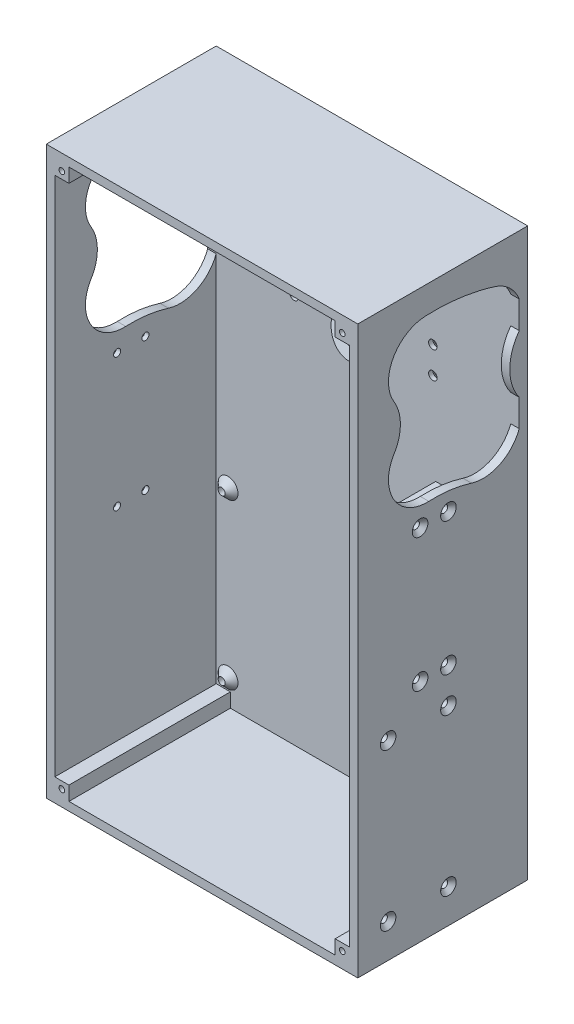
from build123d import *

# Parameters (mm, degrees)
SZKIC1_W                         = 110
SZKIC1_H                         = 60
DODANIE_WYCI_GNI_CIE1_DEPTH      = 200
SKORUPA1_T                       = -3
SZKIC16_W                        = 5
SZKIC16_H                        = 5
SZKIC16_R                        = 1
DODANIE_WYCI_GNI_CIE11_DEPTH     = 57
SZKIC8_W                         = 5
SZKIC8_H                         = 5
SZKIC8_R                         = 1
DODANIE_WYCI_GNI_CIE14_DEPTH     = 57
SZKIC12_W                        = 5
SZKIC12_H                        = 5
SZKIC12_R                        = 1
DODANIE_WYCI_GNI_CIE16_DEPTH     = 57
SZKIC14_W                        = 5
SZKIC14_H                        = 5
SZKIC14_R                        = 1
DODANIE_WYCI_GNI_CIE17_DEPTH     = 57
SZKIC17_W                        = 18.67
SZKIC17_H                        = 7.6
DODANIE_WYCI_GNI_CIE18_DEPTH     = 26.5
SZKIC18_R                        = 1.5
WYTNIJ_WYCI_GNI_CIE2_DEPTH       = 5
SZKIC19_R                        = 1.5
WYTNIJ_WYCI_GNI_CIE3_DEPTH       = 5
SZKIC21_R                        = 1.25
WYTNIJ_WYCI_GNI_CIE4_DEPTH       = 125
SFAZOWANIE3_SIZE                 = 1.5
WYTNIJ_WYCI_GNI_CIE5_DEPTH       = 10
WYTNIJ_WYCI_GNI_CIE10_DEPTH      = 125
WYTNIJ_WYCI_GNI_CIE10_DEPTH_BACK = 3
OBR_T1_ANGLE                     = 20
SZKIC49_R                        = 5.5
WYTNIJ_WYCI_GNI_CIE11_DEPTH      = 3
OBR_T2_ANGLE                     = 20
SZKIC51_R                        = 5.5
WYTNIJ_WYCI_GNI_CIE12_DEPTH      = 3
SZKIC52_R                        = 1.5
WYTNIJ_WYCI_GNI_CIE13_DEPTH      = 3
SFAZOWANIE4_SIZE                 = 1.5
SZKIC77_R                        = 1.25
SZKIC77_R_2                      = 1.247751647
WYTNIJ_WYCI_GNI_CIE16_DEPTH      = 4
SZKIC61_R                        = 1.25
WYTNIJ_WYCI_GNI_CIE17_DEPTH      = 10
SZKIC63_R                        = 1.25
WYTNIJ_WYCI_GNI_CIE18_DEPTH      = 10
SZKIC65_R                        = 1.25
WYTNIJ_WYCI_GNI_CIE19_DEPTH      = 10
SZKIC59_R                        = 1.25
WYTNIJ_WYCI_GNI_CIE20_DEPTH      = 10
SFAZOWANIE5_SIZE                 = 1.5


with BuildPart() as part:
    # Szkic1 → Dodanie-wyciągnięcie1 (new body)
    with BuildSketch(Plane(origin=(0, 0, 0), x_dir=(1, 0, 0), z_dir=(0, 1, 0))):
        with Locations((55, 30)):
            Rectangle(SZKIC1_W, SZKIC1_H)
    extrude(amount=DODANIE_WYCI_GNI_CIE1_DEPTH)

    # Skorupa1
    skorupa1_openings = [part.faces().sort_by_distance(p)[0] for p in [
        (55, 100, 0),
    ]]
    offset(amount=SKORUPA1_T, openings=skorupa1_openings, kind=Kind.INTERSECTION)

    # Szkic16 → Dodanie-wyciągnięcie11 (add)
    with BuildSketch(Plane.XY.offset(-57)):
        with Locations((5.5, 5.5)):
            Rectangle(SZKIC16_W, SZKIC16_H)
        with Locations(Location((5.5, 5.5, 0), (0, 0, 180))):
            Circle(SZKIC16_R, mode=Mode.SUBTRACT)
    extrude(amount=DODANIE_WYCI_GNI_CIE11_DEPTH)

    # Szkic8 → Dodanie-wyciągnięcie14 (add)
    with BuildSketch(Plane.XY.offset(-57)):
        with Locations((5.5, 194.5)):
            Rectangle(SZKIC8_W, SZKIC8_H)
        with Locations(Location((5.5, 194.5, 0), (0, 0, 180))):
            Circle(SZKIC8_R, mode=Mode.SUBTRACT)
    extrude(amount=DODANIE_WYCI_GNI_CIE14_DEPTH)

    # Szkic12 → Dodanie-wyciągnięcie16 (add)
    with BuildSketch(Plane.XY.offset(-57)):
        with Locations((104.5, 194.5)):
            Rectangle(SZKIC12_W, SZKIC12_H)
        with Locations(Location((104.5, 194.5, 0), (0, 0, 180))):
            Circle(SZKIC12_R, mode=Mode.SUBTRACT)
    extrude(amount=DODANIE_WYCI_GNI_CIE16_DEPTH)

    # Szkic14 → Dodanie-wyciągnięcie17 (add)
    with BuildSketch(Plane.XY.offset(-57)):
        with Locations((104.5, 5.5)):
            Rectangle(SZKIC14_W, SZKIC14_H)
        with Locations(Location((104.5, 5.5, 0), (0, 0, 180))):
            Circle(SZKIC14_R, mode=Mode.SUBTRACT)
    extrude(amount=DODANIE_WYCI_GNI_CIE17_DEPTH)

    # Szkic17 → Dodanie-wyciągnięcie18 (add)
    with BuildSketch(Plane(origin=(107, -8.591163908, 0.302484682), x_dir=(0, 0, 1), z_dir=(-1, 0, 0))):
        with Locations((-47.966196848, 113.391163908)):
            Rectangle(SZKIC17_W, SZKIC17_H)
        with Locations((-47.966196848, 64.791163908)):
            Rectangle(SZKIC17_W, SZKIC17_H)
    extrude(amount=DODANIE_WYCI_GNI_CIE18_DEPTH)

    # Szkic18 → Wytnij-wyciągnięcie2 (cut)
    with BuildSketch(Plane.ZY.offset(-80.5)):
        with Locations((-42.328712166, 105.6)):
            Circle(SZKIC18_R)
        with Locations((-51.978712166, 105.6)):
            Circle(SZKIC18_R)
    extrude(amount=-WYTNIJ_WYCI_GNI_CIE2_DEPTH, mode=Mode.SUBTRACT)

    # Szkic19 → Wytnij-wyciągnięcie3 (cut)
    with BuildSketch(Plane.ZY.offset(-80.5)):
        with Locations((-42.328712166, 55.4)):
            Circle(SZKIC19_R)
        with Locations((-51.978712166, 55.4)):
            Circle(SZKIC19_R)
    extrude(amount=-WYTNIJ_WYCI_GNI_CIE3_DEPTH, mode=Mode.SUBTRACT)

    # Szkic21 → Wytnij-wyciągnięcie4 (cut)
    with BuildSketch(Plane(origin=(110, 0, 0), x_dir=(0, 0, -1), z_dir=(1, 0, 0))):
        with Locations((22, 79.68)):
            Circle(SZKIC21_R)
        with Locations((32, 79.68)):
            Circle(SZKIC21_R)
        with Locations((22, 126.68)):
            Circle(SZKIC21_R)
        with Locations((32, 126.68)):
            Circle(SZKIC21_R)
    extrude(amount=-WYTNIJ_WYCI_GNI_CIE4_DEPTH, mode=Mode.SUBTRACT)

    # Sfazowanie3
    sfazowanie3_edges = [part.edges().sort_by_distance(p)[0] for p in [
        (0, 79.68, -30.75),
        (110, 79.68, -30.75),
        (0, 126.68, -20.75),
        (110, 126.68, -20.75),
        (0, 126.68, -30.75),
        (110, 126.68, -30.75),
        (0, 79.68, -20.75),
        (110, 79.68, -20.75),
    ]]
    chamfer(sfazowanie3_edges, length=SFAZOWANIE3_SIZE)

    # Szkic22 → Wytnij-wyciągnięcie5 (cut)
    with BuildSketch(Plane(origin=(0, 108.6, 0), x_dir=(1, 0, 0), z_dir=(0, 1, 0))):
        Polygon((107, 38.328712166), (107, 53.328712166), (98, 38.328712166), align=None)
    extrude(amount=-WYTNIJ_WYCI_GNI_CIE5_DEPTH, mode=Mode.SUBTRACT)

    # Szkic43 → Wytnij-wyciągnięcie10 (cut, two sides: drawn at the far end of the back side and taken through both)
    with BuildSketch(Plane.ZY.offset(-107).offset(-WYTNIJ_WYCI_GNI_CIE10_DEPTH_BACK)):
        with BuildLine():
            Line((-57, 139.486259461), (-57, 149.084398721))
            ThreePointArc((-57, 149.084398721), (-53.660434131, 159.26748297), (-57, 169.45056722))
            Line((-57, 169.45056722), (-57, 179.13))
            ThreePointArc((-57, 179.13), (-53.587257675, 184.182999059), (-48.312265443, 187.241440921))
            add(Edge.make_bspline(
                [(-48.312265443, 187.241440921), (-36.372382541, 190.991671922), (-23.868485606, 190.464796498)],
                knots=[0, 0, 0, 1, 1, 1], degree=2))
            ThreePointArc((-23.868485606, 190.464796498), (-12.442571822, 183.278441717), (-12.802524056, 169.785271768))
            ThreePointArc((-12.802524056, 169.785271768), (-15.031043783, 162.340167335), (-13.35894892, 154.750702336))
            ThreePointArc((-13.35894892, 154.750702336), (-12.486657034, 140.329264051), (-25.067521941, 133.225700613))
            ThreePointArc((-25.067521941, 133.225700613), (-32.692942064, 132.899430143), (-40.145571598, 131.252676521))
            ThreePointArc((-40.145571598, 131.252676521), (-50.215263308, 132.007259851), (-57, 139.486259461))
        make_face()
    extrude(amount=WYTNIJ_WYCI_GNI_CIE10_DEPTH + WYTNIJ_WYCI_GNI_CIE10_DEPTH_BACK, mode=Mode.SUBTRACT)

    # Szkic24 → Obrót1 (revolve)
    with BuildSketch(Plane.XY.offset(-57)):
        with BuildLine():
            ThreePointArc((61.476013564, 174.23), (55, 188.226396394), (48.523986436, 174.23))
            add(Edge.make_bspline(
                [(48.523986436, 174.23), (55, 174.197951548), (61.476013564, 174.23)],
                knots=[0, 0, 0, 1, 1, 1], degree=2))
        make_face()
    revolve(axis=Axis((3, 174.2, -57), (1, 0, 0)), revolution_arc=OBR_T1_ANGLE)

    # Szkic49 → Wytnij-wyciągnięcie11 (cut)
    with BuildSketch(Plane(origin=(0, 38.69697588, -106.319067433), x_dir=(1, 0, 0), z_dir=(0, -0.34202014332566943, 0.9396926207859082))):
        with Locations(Location((54.976687385, 149.699306371, 0), (0, 0, 270))):
            Circle(SZKIC49_R)
    extrude(amount=-WYTNIJ_WYCI_GNI_CIE11_DEPTH, mode=Mode.SUBTRACT)

    # Szkic50 → Obrót2 (revolve)
    with BuildSketch(Plane.XY.offset(-57)):
        with BuildLine():
            ThreePointArc((47.85278396, 148.65), (54.976687385, 134.15), (62.100590809, 148.65))
            add(Edge.make_bspline(
                [(47.85278396, 148.65), (54.976687385, 148.678746146), (62.100590809, 148.65)],
                knots=[0, 0, 0, 1, 1, 1], degree=2))
        make_face()
    revolve(axis=Axis((54.976687385, 148.716828984, -57), (-1, 0, 0)), revolution_arc=OBR_T2_ANGLE)

    # Szkic51 → Wytnij-wyciągnięcie12 (cut)
    with BuildSketch(Plane(origin=(0, -0.922882605, -2.535599117), x_dir=(1, 0, 0), z_dir=(0, 0.34202014332566943, 0.9396926207859082))):
        with Locations(Location((54.976687385, 153.690799041, 0), (0, 0, 270))):
            Circle(SZKIC51_R)
    extrude(amount=-WYTNIJ_WYCI_GNI_CIE12_DEPTH, mode=Mode.SUBTRACT)

    # Szkic52 → Wytnij-wyciągnięcie13 (cut)
    with BuildSketch(Plane.XY.offset(-57)):
        with Locations((30.5, 182.46)):
            Circle(SZKIC52_R)
        with Locations((30.5, 172.96)):
            Circle(SZKIC52_R)
        with Locations((30.5, 149.96)):
            Circle(SZKIC52_R)
        with Locations((30.5, 140.46)):
            Circle(SZKIC52_R)
        with Locations((79.5, 140.46)):
            Circle(SZKIC52_R)
        with Locations((79.5, 149.96)):
            Circle(SZKIC52_R)
        with Locations((79.5, 172.96)):
            Circle(SZKIC52_R)
        with Locations((79.5, 182.46)):
            Circle(SZKIC52_R)
    extrude(amount=-WYTNIJ_WYCI_GNI_CIE13_DEPTH, mode=Mode.SUBTRACT)

    # Sfazowanie4
    sfazowanie4_edges = [part.edges().sort_by_distance(p)[0] for p in [
        (29, 172.96, -60),
        (29, 149.96, -60),
        (29, 140.46, -60),
        (78, 140.46, -60),
        (78, 149.96, -60),
        (78, 172.96, -60),
        (78, 182.46, -60),
        (29, 182.46, -60),
    ]]
    chamfer(sfazowanie4_edges, length=SFAZOWANIE4_SIZE)

    # Wyciągnięcie po profilach6: read off the stored shape, not the designer's step
    # Wyciągnięcie po profilach6: loft between two sections, ruled curve by curve
    wyci_gni_cie_po_profilach6_from = [
        Edge.make_bspline([(6.120855549, 12.626363654, -52.76), (7.373582857, 14.784652555, -52.76), (9.531871759, 13.531925248, -52.76), (8.279144451, 11.373636346, -52.76), (7.026417143, 9.215347445, -52.76), (4.868128241, 10.468074752, -52.76), (6.120855549, 12.626363654, -52.76)], [0, 0, 0, 0, 0.5, 0.5, 0.5, 1, 1, 1, 1], 3, [1, 0.333333333, 0.333333333, 1, 0.333333333, 0.333333333, 1]),
    ]
    wyci_gni_cie_po_profilach6_to = [
        Edge.make_bspline([(10.596507414, 12.844829799, -57), (12.286167011, 6.051814972, -57), (5.493152184, 4.362155374, -57), (3.803492586, 11.155170201, -57), (2.113832989, 17.948185028, -57), (8.906847816, 19.637844626, -57), (10.596507414, 12.844829799, -57)], [0, 0, 0, 0, 0.5, 0.5, 0.5, 1, 1, 1, 1], 3, [1, 0.333333333, 0.333333333, 1, 0.333333333, 0.333333333, 1]),
    ]
    wyci_gni_cie_po_profilach6 = Solid(Shell([*[Face.make_surface_from_curves(wyci_gni_cie_po_profilach6_from[k], wyci_gni_cie_po_profilach6_to[k]) for k in range(1)], Face(Wire(wyci_gni_cie_po_profilach6_from)), Face(Wire(wyci_gni_cie_po_profilach6_to))]))
    add(wyci_gni_cie_po_profilach6)

    # Wyciągnięcie po profilach7: read off the stored shape, not the designer's step
    # Wyciągnięcie po profilach7: loft between two sections, ruled curve by curve
    wyci_gni_cie_po_profilach7_from = [
        Edge.make_bspline([(55.058494512, 12.509377288, -52.76), (56.077249088, 14.792388263, -52.76), (58.360260064, 13.773633688, -52.76), (57.341505488, 11.490622712, -52.76), (56.322750912, 9.207611737, -52.76), (54.039739936, 10.226366312, -52.76), (55.058494512, 12.509377288, -52.76)], [0, 0, 0, 0, 0.5, 0.5, 0.5, 1, 1, 1, 1], 3, [1, 0.333333333, 0.333333333, 1, 0.333333333, 0.333333333, 1]),
    ]
    wyci_gni_cie_po_profilach7_to = [
        Edge.make_bspline([(59.671847469, 12.443029518, -57), (60.557906505, 5.499334581, -57), (53.614211568, 4.613275544, -57), (52.728152531, 11.556970482, -57), (51.842093495, 18.500665419, -57), (58.785788432, 19.386724456, -57), (59.671847469, 12.443029518, -57)], [0, 0, 0, 0, 0.5, 0.5, 0.5, 1, 1, 1, 1], 3, [1, 0.333333333, 0.333333333, 1, 0.333333333, 0.333333333, 1]),
    ]
    wyci_gni_cie_po_profilach7 = Solid(Shell([*[Face.make_surface_from_curves(wyci_gni_cie_po_profilach7_from[k], wyci_gni_cie_po_profilach7_to[k]) for k in range(1)], Face(Wire(wyci_gni_cie_po_profilach7_from)), Face(Wire(wyci_gni_cie_po_profilach7_to))]))
    add(wyci_gni_cie_po_profilach7)

    # Wyciągnięcie po profilach8: read off the stored shape, not the designer's step
    # Wyciągnięcie po profilach8: loft between two sections, ruled curve by curve
    wyci_gni_cie_po_profilach8_from = [
        Edge.make_bspline([(54.993068325, 70.32529361, -52.76), (55.643655544, 72.739156959, -52.76), (58.057518894, 72.08856974, -52.76), (57.406931675, 69.67470639, -52.76), (56.756344456, 67.260843041, -52.76), (54.342481106, 67.91143026, -52.76), (54.993068325, 70.32529361, -52.76)], [0, 0, 0, 0, 0.5, 0.5, 0.5, 1, 1, 1, 1], 3, [1, 0.333333333, 0.333333333, 1, 0.333333333, 0.333333333, 1]),
    ]
    wyci_gni_cie_po_profilach8_to = [
        Edge.make_bspline([(59.258559216, 68.298466714, -57), (55.855492645, 62.181348282, -57), (49.738374213, 65.584414854, -57), (53.141440784, 71.701533286, -57), (56.544507355, 77.818651718, -57), (62.661625787, 74.415585146, -57), (59.258559216, 68.298466714, -57)], [0, 0, 0, 0, 0.5, 0.5, 0.5, 1, 1, 1, 1], 3, [1, 0.333333333, 0.333333333, 1, 0.333333333, 0.333333333, 1]),
    ]
    wyci_gni_cie_po_profilach8 = Solid(Shell([*[Face.make_surface_from_curves(wyci_gni_cie_po_profilach8_from[k], wyci_gni_cie_po_profilach8_to[k]) for k in range(1)], Face(Wire(wyci_gni_cie_po_profilach8_from)), Face(Wire(wyci_gni_cie_po_profilach8_to))]))
    add(wyci_gni_cie_po_profilach8)

    # Wyciągnięcie po profilach9: read off the stored shape, not the designer's step
    # Wyciągnięcie po profilach9: loft between two sections, ruled curve by curve
    wyci_gni_cie_po_profilach9_from = [
        Edge.make_bspline([(6.036914085, 70.45796414, -52.76), (6.952842366, 72.784135971, -52.76), (9.279014196, 71.86820769, -52.76), (8.363085915, 69.54203586, -52.76), (7.447157634, 67.215864029, -52.76), (5.120985804, 68.13179231, -52.76), (6.036914085, 70.45796414, -52.76)], [0, 0, 0, 0, 0.5, 0.5, 0.5, 1, 1, 1, 1], 3, [1, 0.333333333, 0.333333333, 1, 0.333333333, 0.333333333, 1]),
    ]
    wyci_gni_cie_po_profilach9_to = [
        Edge.make_bspline([(10.389005871, 71.442304251, -57), (13.273614374, 65.064292509, -57), (6.895602631, 62.179684006, -57), (4.010994129, 68.557695749, -57), (1.126385626, 74.935707491, -57), (7.504397369, 77.820315994, -57), (10.389005871, 71.442304251, -57)], [0, 0, 0, 0, 0.5, 0.5, 0.5, 1, 1, 1, 1], 3, [1, 0.333333333, 0.333333333, 1, 0.333333333, 0.333333333, 1]),
    ]
    wyci_gni_cie_po_profilach9 = Solid(Shell([*[Face.make_surface_from_curves(wyci_gni_cie_po_profilach9_from[k], wyci_gni_cie_po_profilach9_to[k]) for k in range(1)], Face(Wire(wyci_gni_cie_po_profilach9_from)), Face(Wire(wyci_gni_cie_po_profilach9_to))]))
    add(wyci_gni_cie_po_profilach9)

    # Szkic77 → Wytnij-wyciągnięcie16 (cut)
    with BuildSketch(Plane.XY.offset(-52.76)):
        with Locations((7.2, 70)):
            Circle(SZKIC77_R)
        with Locations((56.2, 70)):
            Circle(SZKIC77_R)
        with Locations((56.2, 12)):
            Circle(SZKIC77_R)
        with Locations((7.2, 12)):
            Circle(SZKIC77_R_2)
    extrude(amount=-WYTNIJ_WYCI_GNI_CIE16_DEPTH, mode=Mode.SUBTRACT)

    # Szkic61 → Wytnij-wyciągnięcie17 (cut)
    with BuildSketch(Plane.ZY.offset(-104.5)):
        with Locations((-10.7, 67.25)):
            Circle(SZKIC61_R)
    extrude(amount=-WYTNIJ_WYCI_GNI_CIE17_DEPTH, mode=Mode.SUBTRACT)

    # Szkic63 → Wytnij-wyciągnięcie18 (cut)
    with BuildSketch(Plane.ZY.offset(-104.5)):
        with Locations((-32, 67.25)):
            Circle(SZKIC63_R)
    extrude(amount=-WYTNIJ_WYCI_GNI_CIE18_DEPTH, mode=Mode.SUBTRACT)

    # Szkic65 → Wytnij-wyciągnięcie19 (cut)
    with BuildSketch(Plane.ZY.offset(-104.5)):
        with Locations((-32, 11.95)):
            Circle(SZKIC65_R)
    extrude(amount=-WYTNIJ_WYCI_GNI_CIE19_DEPTH, mode=Mode.SUBTRACT)

    # Szkic59 → Wytnij-wyciągnięcie20 (cut)
    with BuildSketch(Plane.ZY.offset(-104.5)):
        with Locations((-10.7, 11.95)):
            Circle(SZKIC59_R)
    extrude(amount=-WYTNIJ_WYCI_GNI_CIE20_DEPTH, mode=Mode.SUBTRACT)

    # Sfazowanie5
    sfazowanie5_edges = [part.edges().sort_by_distance(p)[0] for p in [
        (110, 67.25, -11.95),
        (110, 67.25, -33.25),
        (110, 11.95, -33.25),
        (110, 11.95, -11.95),
    ]]
    chamfer(sfazowanie5_edges, length=SFAZOWANIE5_SIZE)


solid = part.part
